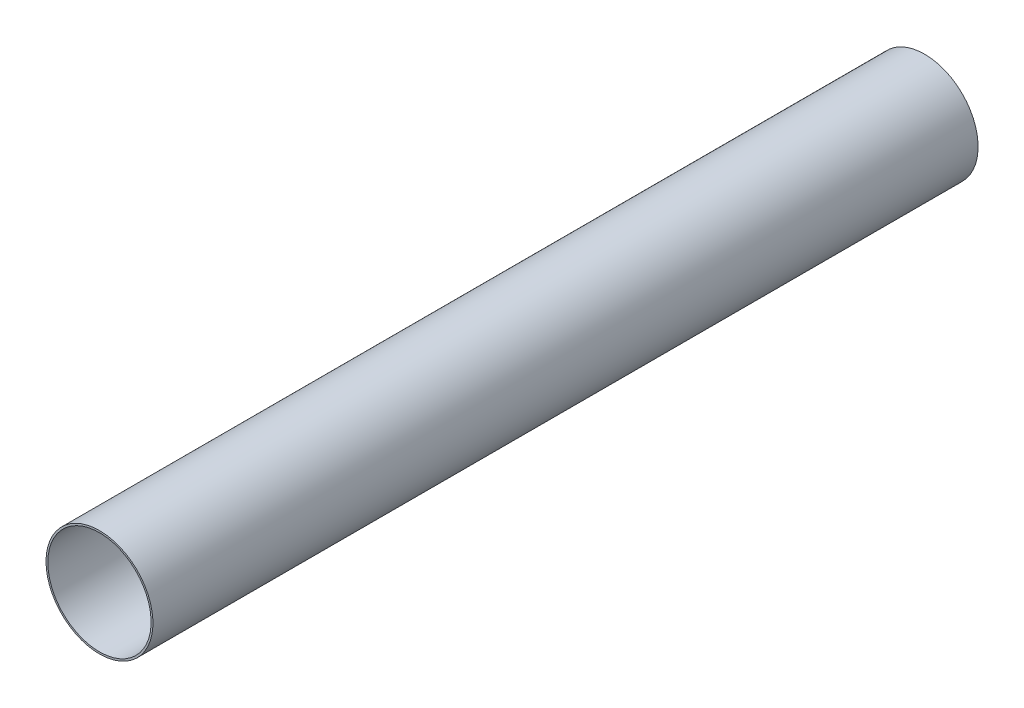
from build123d import *

# Parameters (mm, degrees)
ESQUISSE1_R        = 79
ESQUISSE1_R_2      = 76.29
BOSS_EXTRU_1_DEPTH = 1219.2


with BuildPart() as part:
    # Esquisse1 → Boss.-Extru.1 (new body)
    with BuildSketch(Plane.XY):
        Circle(ESQUISSE1_R)
        Circle(ESQUISSE1_R_2, mode=Mode.SUBTRACT)
    extrude(amount=BOSS_EXTRU_1_DEPTH)


solid = part.part
